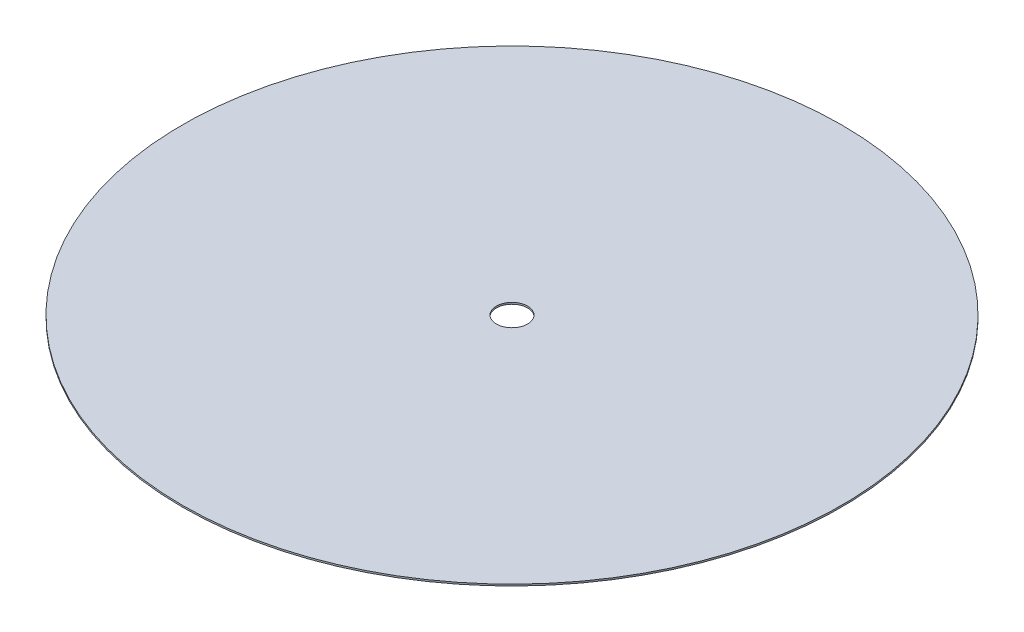
from build123d import *

# Parameters (mm, degrees)
CROQUIS1_R              = 403.28
CROQUIS1_R_2            = 19.05
SALIENTE_EXTRUIR1_DEPTH = 2


with BuildPart() as part:
    # Croquis1 → Saliente-Extruir1 (new body)
    with BuildSketch(Plane(origin=(0, 0, 0), x_dir=(1, 0, 0), z_dir=(0, 1, 0))):
        Circle(CROQUIS1_R)
        Circle(CROQUIS1_R_2, mode=Mode.SUBTRACT)
    extrude(amount=SALIENTE_EXTRUIR1_DEPTH)


solid = part.part
